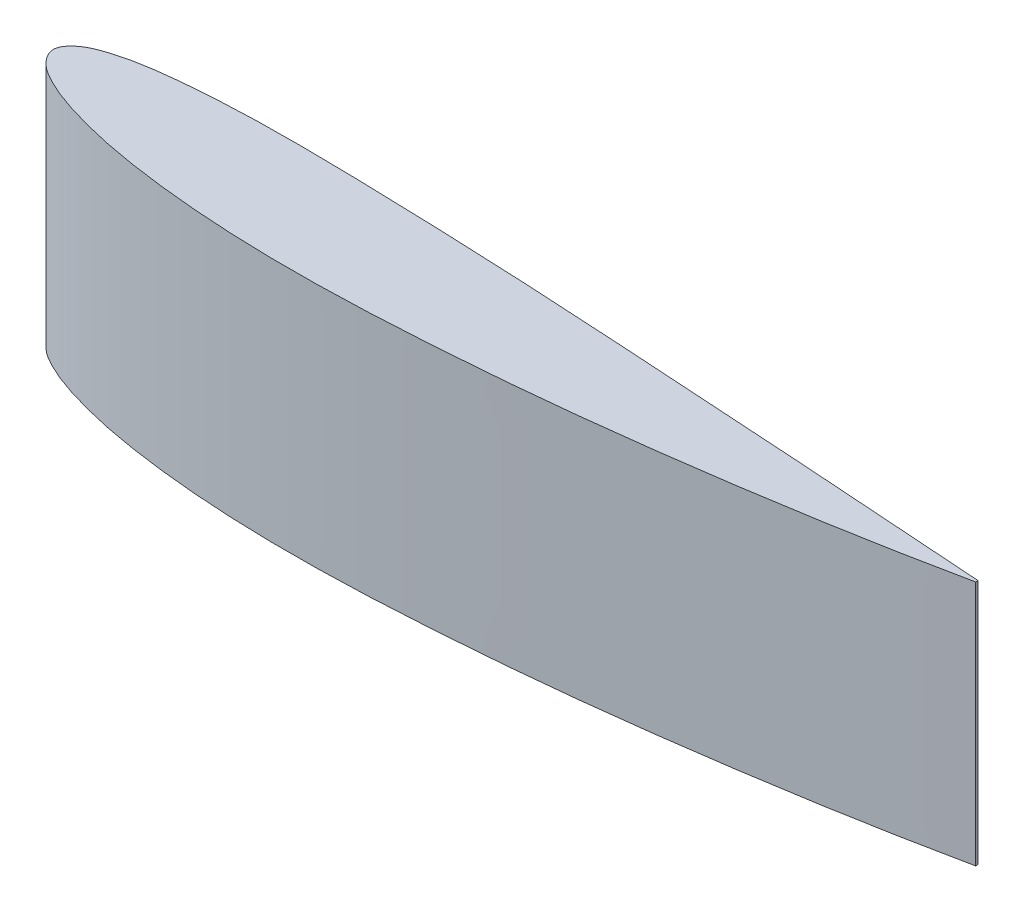
from build123d import *

# Parameters (mm, degrees)
BOSS_EXTRUDE1_DEPTH   = 80
BODY_MOVE_COPY2_ANGLE = 90


with BuildPart() as part:
    # Sketch1 → Boss-Extrude1 (new body)
    with BuildSketch(Plane.XY):
        with BuildLine():
            Line((269.75606318, 0.39), (269.75606318, -0.39))
            add(Edge.make_bspline(
                [(269.75606318, 0.39), (264.758836378, 1.414000082), (254.777507596, 3.45931079), (234.797708888, 7.205579334), (209.809502227, 11.35644797), (179.803810027, 15.652495779), (149.803067524, 19.235240906), (119.789318532, 21.858580513), (89.782404697, 23.635097209), (64.746727737, 23.935808407), (44.737918653, 23.107465721), (29.719041415, 21.893704318), (14.681203014, 19.97163417), (2.165982385, 17.604753461), (-7.811397109, 14.926973956), (-15.375659845, 12.492476274), (-21.78446685, 9.655920822), (-27.312645833, 6.216911108), (-32.133405509, 0.269631354), (-27.125920641, -4.957920198), (-21.701145045, -7.342160266), (-15.320533432, -9.153243486), (-7.781174347, -10.451795047), (2.236136575, -11.559964158), (14.740172541, -12.412907572), (29.754296801, -12.754877712), (44.757705477, -12.707223024), (64.759558695, -12.26571363), (89.764209215, -11.471242967), (119.766079926, -10.088623246), (149.759251014, -8.291561108), (179.757509222, -6.423658887), (209.760896614, -4.532938454), (234.755492949, -2.791593222), (254.757335305, -1.448461772), (264.756258336, -0.742836743), (269.75606318, -0.39)],
                knots=[0, 0, 0, 0, 0.02501249, 0.049959286, 0.099672925, 0.14920632, 0.198581097, 0.24780517, 0.296916575, 0.345952722, 0.370491626, 0.395091204, 0.419814796, 0.444798575, 0.457489819, 0.470406405, 0.483879409, 0.49126412, 0.503458853, 0.513609129, 0.520450991, 0.533235388, 0.545691039, 0.558031884, 0.582609167, 0.607134742, 0.63165208, 0.656174272, 0.705233949, 0.754320379, 0.803437364, 0.852566096, 0.901700994, 0.950848809, 0.975422717, 1, 1, 1, 1], degree=3))
        make_face()
    extrude(amount=BOSS_EXTRUDE1_DEPTH)


with BuildPart() as part_1:
    # Body-Move/Copy2: moved
    add(part.part.rotate(Axis((0, 0, 0), (1, 0, 0)), BODY_MOVE_COPY2_ANGLE))


solid = part_1.part
